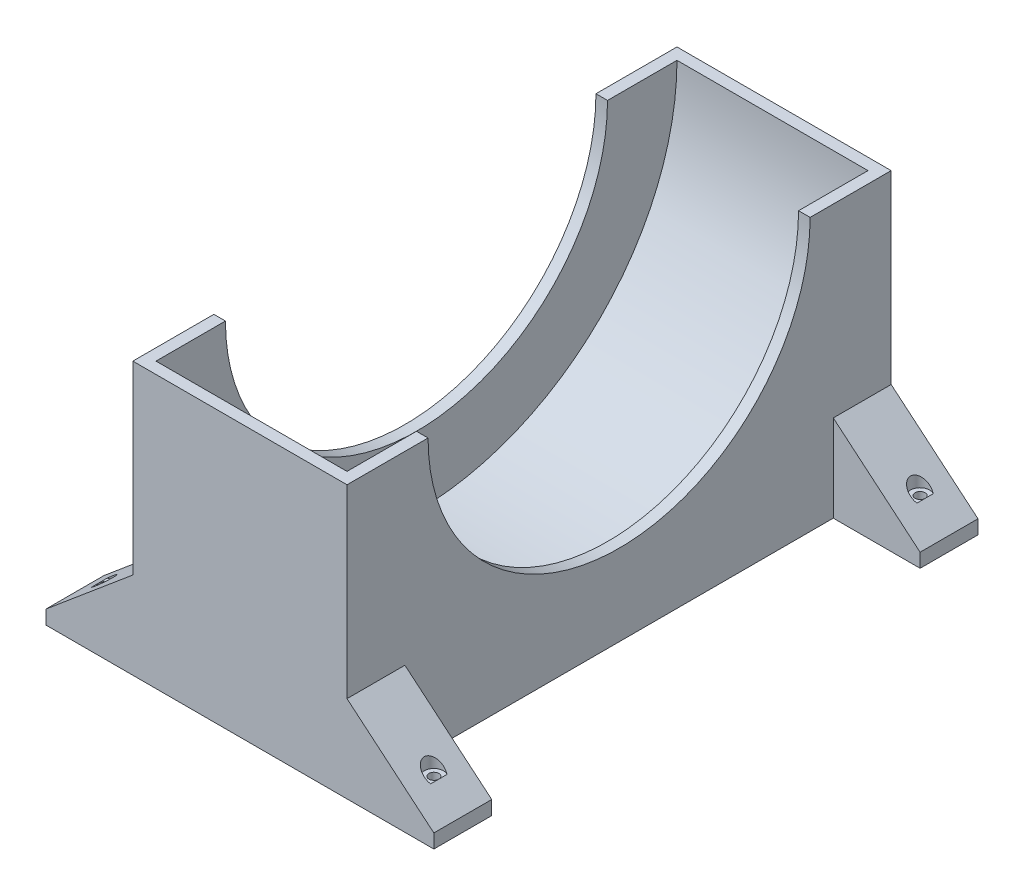
from build123d import *
from OCP.BRepFilletAPI import BRepFilletAPI_MakeChamfer

# Parameters (mm, degrees)
BOSS_EXTRUDE1_DEPTH        = 93.98
SHELL2_T                   = -5.08
BOSS_EXTRUDE2_DEPTH        = 93.98
SKETCH9_W                  = 31.75
SKETCH9_H                  = 12.7
BOSS_EXTRUDE3_DEPTH        = 25.4
SKETCH8_R                  = 2.1828125
CUT_EXTRUDE2_DEPTH         = 210.869181158
SKETCH10_W                 = 25.4
SKETCH10_H                 = 38.1
BOSS_EXTRUDE4_DEPTH        = 38.1
CHAMFER1_SIZE              = 38.1
CHAMFER1_SIZE_2            = 31.969695948
CHAMFER1_OF_MIRROR3_SIZE   = 38.1
CHAMFER1_OF_MIRROR3_SIZE_2 = 31.969695948
SKETCH13_R                 = 2.1828125
CUT_EXTRUDE4_DEPTH         = 230.473221096
SKETCH15_W                 = 93.98
SKETCH15_H                 = 25.4
CUT_EXTRUDE5_DEPTH         = 230.473221096
CUT_EXTRUDE6_START         = 40.355266
SKETCH14_R                 = 4.191
CUT_EXTRUDE6_DEPTH         = 25.4


with BuildPart() as part:
    # Sketch1 → Boss-Extrude1 (new body)
    with BuildSketch(Plane(origin=(0, 0, 0), x_dir=(0, 0, -1), z_dir=(1, 0, 0))):
        with BuildLine():
            Line((-119.38, 0), (-83.82, 0))
            ThreePointArc((-83.82, 0), (0, -83.82), (83.82, 0))
            Line((83.82, 0), (119.38, 0))
            ThreePointArc((119.38, 0), (0, -119.38), (-119.38, 0))
        make_face()
    extrude(amount=BOSS_EXTRUDE1_DEPTH)

    # Shell2
    shell2_openings = [part.faces().sort_by_distance(p)[0] for p in [
        (46.99, 0, 101.6),
        (46.99, -83.82, 0),
        (46.99, 0, -101.6),
    ]]
    offset(amount=SHELL2_T, openings=shell2_openings, kind=Kind.INTERSECTION)

    # Sketch6 → Boss-Extrude2 (add)
    with BuildSketch(Plane(origin=(0, 0, 0), x_dir=(0, 0, -1), z_dir=(1, 0, 0))):
        with BuildLine():
            Line((-119.38, 0), (-119.38, -119.38))
            Line((-119.38, -119.38), (0, -119.38))
            ThreePointArc((0, -119.38), (-84.414407538, -84.414407538), (-119.38, 0))
        make_face()
    boss_extrude2 = extrude(amount=BOSS_EXTRUDE2_DEPTH)

    # Sketch9 → Boss-Extrude3 (add)
    with BuildSketch(Plane.XY.offset(119.38)):
        with Locations((15.875, -113.03)):
            Rectangle(SKETCH9_W, SKETCH9_H)
        with Locations((78.105, -113.03)):
            Rectangle(SKETCH9_W, SKETCH9_H)
    boss_extrude3 = extrude(amount=BOSS_EXTRUDE3_DEPTH)

    # Sketch8 → Cut-Extrude2 (cut, through all)
    with BuildSketch(Plane(origin=(0, 0, 0), x_dir=(1, 0, 0), z_dir=(0, 1, 0))):
        with Locations(Location((15.875, -132.08, 0), (0, 0, 270))):
            Circle(SKETCH8_R)
        with Locations(Location((78.74, -132.08, 0), (0, 0, 270))):
            Circle(SKETCH8_R)
    cut_extrude2 = extrude(amount=-CUT_EXTRUDE2_DEPTH, mode=Mode.SUBTRACT)

    # Mirror2: Boss-Extrude2, Boss-Extrude3, Cut-Extrude2 across plane
    add(boss_extrude2.mirror(Plane.XY))
    add(boss_extrude3.mirror(Plane.XY))
    add(cut_extrude2.mirror(Plane.XY), mode=Mode.SUBTRACT)

    # Sketch10 → Boss-Extrude4 (add)
    with BuildSketch(Plane.ZY):
        with Locations((-106.68, -100.33)):
            Rectangle(SKETCH10_W, SKETCH10_H)
        with Locations((106.68, -100.33)):
            Rectangle(SKETCH10_W, SKETCH10_H)
    boss_extrude4 = extrude(amount=BOSS_EXTRUDE4_DEPTH)

    # Chamfer1
    chamfer1_edges_1 = [part.edges().sort_by_distance(p)[0] for p in [
        (-38.1, -81.28, 106.68),
    ]]
    chamfer1_side_1 = [part.faces().sort_by_distance(p)[0] for p in [
        (-37.460606081, -81.28, 106.68),
    ]]
    chamfer1_edges_2 = [part.edges().sort_by_distance(p)[0] for p in [
        (-38.1, -81.28, -106.68),
    ]]
    chamfer1_side_2 = [part.faces().sort_by_distance(p)[0] for p in [
        (-37.460606081, -81.28, -106.68),
    ]]
    chamfer1 = BRepFilletAPI_MakeChamfer(part.part.solid().wrapped)
    for e in chamfer1_edges_1:
        chamfer1.Add(CHAMFER1_SIZE - 0.0001, CHAMFER1_SIZE_2 - 0.0001, e.wrapped, chamfer1_side_1[0].wrapped)
    for e in chamfer1_edges_2:
        chamfer1.Add(CHAMFER1_SIZE - 0.0001, CHAMFER1_SIZE_2 - 0.0001, e.wrapped, chamfer1_side_2[0].wrapped)
    add(Compound.cast(chamfer1.Shape()), mode=Mode.REPLACE)  # a hair under: the kernel refuses the full size

    # Mirror3: Boss-Extrude4 across plane
    add(boss_extrude4.mirror(Plane(origin=(46.99, 0, 0), x_dir=(0, 0, 1), z_dir=(1, 0, 0))))

    # Chamfer1 of Mirror3
    chamfer1_of_mirror3_edges_1 = [part.edges().sort_by_distance(p)[0] for p in [
        (132.08, -81.28, 106.68),
    ]]
    chamfer1_of_mirror3_side_1 = [part.faces().sort_by_distance(p)[0] for p in [
        (131.440606081, -81.28, 106.68),
    ]]
    chamfer1_of_mirror3_edges_2 = [part.edges().sort_by_distance(p)[0] for p in [
        (132.08, -81.28, -106.68),
    ]]
    chamfer1_of_mirror3_side_2 = [part.faces().sort_by_distance(p)[0] for p in [
        (131.440606081, -81.28, -106.68),
    ]]
    chamfer1_of_mirror3 = BRepFilletAPI_MakeChamfer(part.part.solid().wrapped)
    for e in chamfer1_of_mirror3_edges_1:
        chamfer1_of_mirror3.Add(CHAMFER1_OF_MIRROR3_SIZE - 0.0001, CHAMFER1_OF_MIRROR3_SIZE_2 - 0.0001, e.wrapped, chamfer1_of_mirror3_side_1[0].wrapped)
    for e in chamfer1_of_mirror3_edges_2:
        chamfer1_of_mirror3.Add(CHAMFER1_OF_MIRROR3_SIZE - 0.0001, CHAMFER1_OF_MIRROR3_SIZE_2 - 0.0001, e.wrapped, chamfer1_of_mirror3_side_2[0].wrapped)
    add(Compound.cast(chamfer1_of_mirror3.Shape()), mode=Mode.REPLACE)  # a hair under: the kernel refuses the full size

    # Sketch13 → Cut-Extrude4 (cut, through all)
    with BuildSketch(Plane(origin=(0, -119.38, 0), x_dir=(1, 0, 0), z_dir=(0, 1, 0))):
        with Locations(Location((-25.4, -106.68, 0), (0, 0, 180))):
            Circle(SKETCH13_R)
        with Locations((119.38, -106.68)):
            Circle(SKETCH13_R)
        with Locations((119.38, 106.68)):
            Circle(SKETCH13_R)
        with Locations(Location((-25.4, 106.68, 0), (0, 0, 180))):
            Circle(SKETCH13_R)
    extrude(amount=CUT_EXTRUDE4_DEPTH, mode=Mode.SUBTRACT)

    # Sketch15 → Cut-Extrude5 (cut, through all)
    with BuildSketch(Plane(origin=(0, -119.38, 0), x_dir=(1, 0, 0), z_dir=(0, 1, 0))):
        with Locations((46.99, -132.08)):
            Rectangle(SKETCH15_W, SKETCH15_H)
        with Locations((46.99, 132.08)):
            Rectangle(SKETCH15_W, SKETCH15_H)
    extrude(amount=CUT_EXTRUDE5_DEPTH, mode=Mode.SUBTRACT)

    # Sketch14 → Cut-Extrude6 (cut)
    with BuildSketch(Plane(origin=(0, -119.38, 0), x_dir=(1, 0, 0), z_dir=(0, 1, 0)).offset(CUT_EXTRUDE6_START)):
        with Locations((-25.4, -106.68)):
            Circle(SKETCH14_R)
        with Locations((119.38, -106.68)):
            Circle(SKETCH14_R)
        with Locations((119.38, 106.68)):
            Circle(SKETCH14_R)
        with Locations((-25.4, 106.68)):
            Circle(SKETCH14_R)
    extrude(amount=-CUT_EXTRUDE6_DEPTH, mode=Mode.SUBTRACT)


solid = part.part
